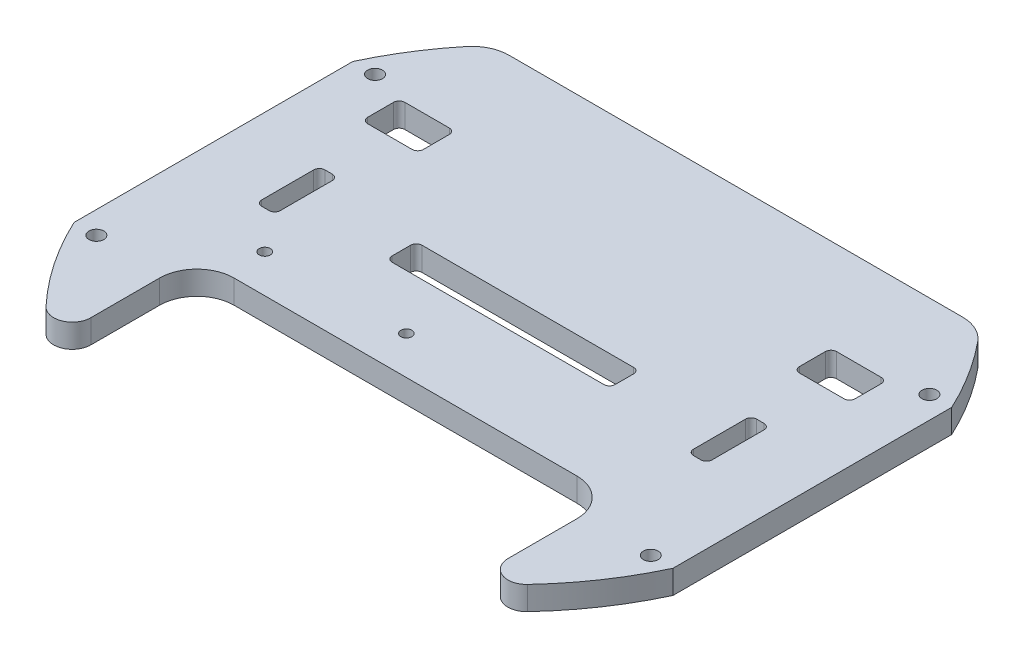
from build123d import *

# Parameters (mm, degrees)
MAIN_BODY_DEPTH    = 6.35
SKETCH6_R          = 1.524
FRONT_IR_DEPTH     = 121.168600308
SKETCH10_W         = 38.1
SKETCH10_H         = 25.908
GRABBER_SLOT_DEPTH = 121.168600308
SKETCH11_W         = 5
SKETCH11_H         = 17
SKETCH11_W_2       = 60
SKETCH11_H_2       = 8
SKETCH11_W_3       = 15
SKETCH11_H_3       = 10
WIRE_SLOTS_DEPTH   = 121.168600308
SKETCH13_R         = 2
F_2ND_LEVEL_DEPTH  = 121.168600308
CUT_EXTRUDE1_DEPTH = 121.168600308
FILLET1_R          = 5
FILLET2_R          = 10
CUT_EXTRUDE2_START = -10
CUT_EXTRUDE2_DEPTH = 10
FILLET3_R          = 10
FILLET4_R          = 1.5
SKETCH17_R         = 1.5
CUT_EXTRUDE3_DEPTH = 103.170168296


with BuildPart() as part:
    # Sketch1 → Main Body (new body)
    with BuildSketch(Plane(origin=(0, 0, 0), x_dir=(1, 0, 0), z_dir=(0, 1, 0))):
        with BuildLine():
            Line((-80.603721998, 37.5), (-80.603721998, -37.5))
            ThreePointArc((-80.603721998, -37.5), (0, -88.9), (80.603721998, -37.5))
            Line((80.603721998, -37.5), (80.603721998, 37.5))
            ThreePointArc((80.603721998, 37.5), (0, 88.9), (-80.603721998, 37.5))
        make_face()
    extrude(amount=MAIN_BODY_DEPTH)

    # Sketch6 → Front IR (cut, through all)
    with BuildSketch(Plane(origin=(0, 6.35, 0), x_dir=(1, 0, 0), z_dir=(0, 1, 0))):
        with Locations((-12.7, -69.596)):
            Circle(SKETCH6_R)
        with Locations((12.7, -69.596)):
            Circle(SKETCH6_R)
    extrude(amount=-FRONT_IR_DEPTH, mode=Mode.SUBTRACT)

    # Sketch10 → Grabber slot (cut, through all)
    with BuildSketch(Plane(origin=(0, 6.35, 0), x_dir=(1, 0, 0), z_dir=(0, 1, 0))):
        with Locations((0, -88.9)):
            Rectangle(SKETCH10_W, SKETCH10_H)
    extrude(amount=-GRABBER_SLOT_DEPTH, mode=Mode.SUBTRACT)

    # Sketch11 → Wire slots (cut, through all)
    with BuildSketch(Plane(origin=(0, 6.35, 0), x_dir=(1, 0, 0), z_dir=(0, 1, 0))):
        with Locations((-58.103721998, 0)):
            Rectangle(SKETCH11_W, SKETCH11_H)
        Rectangle(SKETCH11_W_2, SKETCH11_H_2)
        with Locations((58.103721998, 0)):
            Rectangle(SKETCH11_W, SKETCH11_H)
        with Locations((58.103721998, 30)):
            Rectangle(SKETCH11_W_3, SKETCH11_H_3)
        with Locations((-58.103721998, 30)):
            Rectangle(SKETCH11_W_3, SKETCH11_H_3)
    extrude(amount=-WIRE_SLOTS_DEPTH, mode=Mode.SUBTRACT)

    # Sketch13 → 2nd level (cut, through all)
    with BuildSketch(Plane(origin=(0, 6.35, 0), x_dir=(1, 0, 0), z_dir=(0, 1, 0))):
        with Locations((74.603721998, -37.5)):
            Circle(SKETCH13_R)
        with Locations((-74.603721998, -37.5)):
            Circle(SKETCH13_R)
        with Locations((74.603721998, 37.5)):
            Circle(SKETCH13_R)
        with Locations((-74.603721998, 37.5)):
            Circle(SKETCH13_R)
    extrude(amount=-F_2ND_LEVEL_DEPTH, mode=Mode.SUBTRACT)

    # Sketch14 → Cut-Extrude1 (cut, through all)
    with BuildSketch(Plane(origin=(0, 6.35, 0), x_dir=(1, 0, 0), z_dir=(0, 1, 0))):
        with BuildLine():
            Line((56.134, -68.93608666), (56.134, -28.93608666))
            Line((56.134, -28.93608666), (-56.134, -28.93608666))
            Line((-56.134, -28.93608666), (-56.134, -68.93608666))
            ThreePointArc((-56.134, -68.93608666), (-38.642602624, -80.062221194), (-19.05, -86.834944003))
            Line((-19.05, -86.834944003), (-19.05, -75.946))
            Line((-19.05, -75.946), (19.05, -75.946))
            Line((19.05, -75.946), (19.05, -86.834944003))
            ThreePointArc((19.05, -86.834944003), (38.642602624, -80.062221194), (56.134, -68.93608666))
        make_face()
    extrude(amount=-CUT_EXTRUDE1_DEPTH, mode=Mode.SUBTRACT)

    # Fillet1
    fillet1_edges = [part.edges().sort_by_distance(p)[0] for p in [
        (-56.134, 3.175, 68.93608666),
        (56.134, 3.175, 68.93608666),
    ]]
    fillet(fillet1_edges, radius=FILLET1_R)

    # Fillet2
    fillet2_edges = [part.edges().sort_by_distance(p)[0] for p in [
        (-56.134, 3.175, 28.93608666),
        (56.134, 3.175, 28.93608666),
    ]]
    fillet(fillet2_edges, radius=FILLET2_R)

    # Sketch16 → Cut-Extrude2 (cut)
    with BuildSketch(Plane(origin=(0, 6.35, 0), x_dir=(1, 0, 0), z_dir=(0, 1, 0)).offset(CUT_EXTRUDE2_START)):
        with BuildLine():
            Line((65.598856697, 60), (-65.598856697, 60))
            ThreePointArc((-65.598856697, 60), (0, 88.9), (65.598856697, 60))
        make_face()
    extrude(amount=CUT_EXTRUDE2_DEPTH, mode=Mode.SUBTRACT)

    # Fillet3
    fillet3_edges = [part.edges().sort_by_distance(p)[0] for p in [
        (-65.598856697, 3.175, -60),
        (65.598856697, 3.175, -60),
    ]]
    fillet(fillet3_edges, radius=FILLET3_R)

    # Fillet4
    fillet4_edges = [part.edges().sort_by_distance(p)[0] for p in [
        (-60.603721998, 3.175, 8.5),
        (-60.603721998, 3.175, -8.5),
        (-55.603721998, 3.175, 8.5),
        (-55.603721998, 3.175, -8.5),
        (55.603721998, 3.175, 8.5),
        (55.603721998, 3.175, -8.5),
        (60.603721998, 3.175, -8.5),
        (60.603721998, 3.175, 8.5),
        (30, 3.175, 4),
        (30, 3.175, -4),
        (-30, 3.175, 4),
        (-30, 3.175, -4),
        (50.603721998, 3.175, -25),
        (50.603721998, 3.175, -35),
        (65.603721998, 3.175, -35),
        (65.603721998, 3.175, -25),
        (-50.603721998, 3.175, -25),
        (-65.603721998, 3.175, -25),
        (-50.603721998, 3.175, -35),
        (-65.603721998, 3.175, -35),
    ]]
    fillet(fillet4_edges, radius=FILLET4_R)

    # Sketch17 → Cut-Extrude3 (cut, through all)
    with BuildSketch(Plane(origin=(0, 6.35, 0), x_dir=(1, 0, 0), z_dir=(0, 1, 0))):
        with Locations((-48.1, -18.678710205)):
            Circle(SKETCH17_R)
        with Locations((-10, -18.678710205)):
            Circle(SKETCH17_R)
    extrude(amount=-CUT_EXTRUDE3_DEPTH, mode=Mode.SUBTRACT)


solid = part.part
